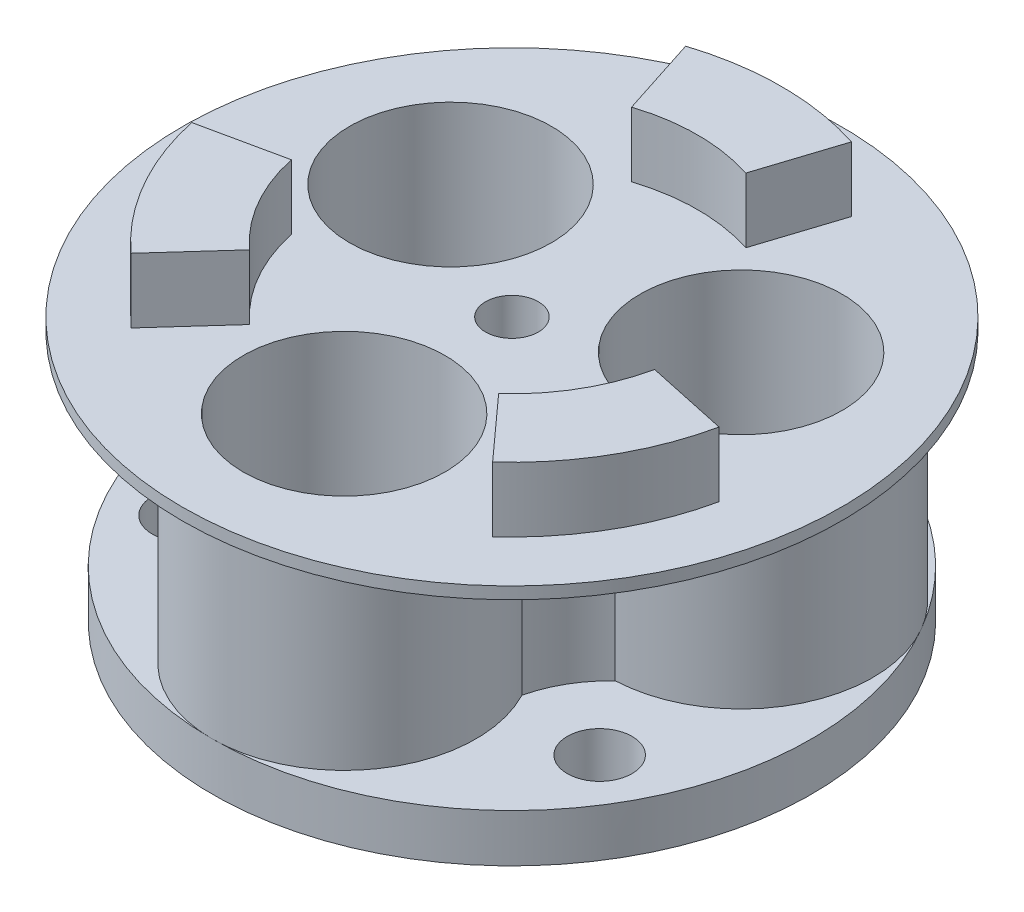
from build123d import *

# Parameters (mm, degrees)
SKETCH1_R           = 27.5
SKETCH1_R_2         = 2.2
SKETCH1_R_3         = 8.425
BOSS_EXTRUDE1_DEPTH = 22
BOSS_EXTRUDE2_DEPTH = 5.4
SKETCH5_R           = 40.989273042
CUT_EXTRUDE1_DEPTH  = 17
SKETCH6_R           = 2.7
CUT_EXTRUDE2_DEPTH  = 5
SKETCH7_R           = 33.756466266
SKETCH7_R_2         = 25
CUT_EXTRUDE6_DEPTH  = 4


with BuildPart() as part:
    # Sketch1 → Boss-Extrude1 (new body)
    with BuildSketch(Plane(origin=(0, 0, 0), x_dir=(1, 0, 0), z_dir=(0, 1, 0))):
        Circle(SKETCH1_R)
        Circle(SKETCH1_R_2, mode=Mode.SUBTRACT)
        with Locations((0, -14)):
            Circle(SKETCH1_R_3, mode=Mode.SUBTRACT)
        with Locations((-12.124355653, 7)):
            Circle(SKETCH1_R_3, mode=Mode.SUBTRACT)
        with Locations((12.124355653, 7)):
            Circle(SKETCH1_R_3, mode=Mode.SUBTRACT)
    extrude(amount=BOSS_EXTRUDE1_DEPTH)

    # Sketch4 → Boss-Extrude2 (add)
    with BuildSketch(Plane(origin=(0, 22, 0), x_dir=(1, 0, 0), z_dir=(0, 1, 0))):
        with BuildLine():
            ThreePointArc((15.15564017, -3.249087725), (13.423393759, -7.75), (10.391612594, -11.500625535))
            Line((10.391612594, -11.500625535), (15.084598927, -16.694456422))
            ThreePointArc((15.084598927, -16.694456422), (19.485571585, -11.25), (22.000122827, -4.716417665))
            Line((22.000122827, -4.716417665), (15.15564017, -3.249087725))
        make_face()
        with BuildLine():
            Line((-15.084598927, -16.694456422), (-10.391612594, -11.500625535))
            ThreePointArc((-10.391612594, -11.500625535), (-13.423393759, -7.75), (-15.15564017, -3.249087725))
            Line((-15.15564017, -3.249087725), (-22.000122827, -4.716417665))
            ThreePointArc((-22.000122827, -4.716417665), (-19.485571585, -11.25), (-15.084598927, -16.694456422))
        make_face()
        with BuildLine():
            ThreePointArc((-4.764027576, 14.74971326), (0, 15.5), (4.764027576, 14.74971326))
            Line((4.764027576, 14.74971326), (6.9155239, 21.410874087))
            ThreePointArc((6.9155239, 21.410874087), (0, 22.5), (-6.9155239, 21.410874087))
            Line((-6.9155239, 21.410874087), (-4.764027576, 14.74971326))
        make_face()
    extrude(amount=BOSS_EXTRUDE2_DEPTH)

    # Sketch5 → Cut-Extrude1 (cut)
    with BuildSketch(Plane(origin=(0, 4, 0), x_dir=(1, 0, 0), z_dir=(0, 1, 0))):
        Circle(SKETCH5_R)
        with BuildLine():
            ThreePointArc((-2.849843175, 12.914678207), (0, 12.5), (2.849843175, 12.914678207))
            ThreePointArc((2.849843175, 12.914678207), (21.650635095, 12.5), (12.609360996, -3.989302517))
            ThreePointArc((12.609360996, -3.989302517), (10.825317547, -6.25), (9.759517821, -8.925375689))
            ThreePointArc((9.759517821, -8.925375689), (0, -25), (-9.759517821, -8.925375689))
            ThreePointArc((-9.759517821, -8.925375689), (-10.825317547, -6.25), (-12.609360996, -3.989302517))
            ThreePointArc((-12.609360996, -3.989302517), (-21.650635095, 12.5), (-2.849843175, 12.914678207))
        make_face(mode=Mode.SUBTRACT)
    extrude(amount=CUT_EXTRUDE1_DEPTH, mode=Mode.SUBTRACT)

    # Sketch6 → Cut-Extrude2 (cut)
    with BuildSketch(Plane.XZ):
        with Locations((0, -20)):
            Circle(SKETCH6_R)
        with Locations((-17.320508076, 10)):
            Circle(SKETCH6_R)
        with Locations((17.320508076, 10)):
            Circle(SKETCH6_R)
    extrude(amount=-CUT_EXTRUDE2_DEPTH, mode=Mode.SUBTRACT)

    # Sketch7 → Cut-Extrude6 (cut)
    with BuildSketch(Plane.XZ):
        Circle(SKETCH7_R)
        Circle(SKETCH7_R_2, mode=Mode.SUBTRACT)
    extrude(amount=-CUT_EXTRUDE6_DEPTH, mode=Mode.SUBTRACT)


solid = part.part
